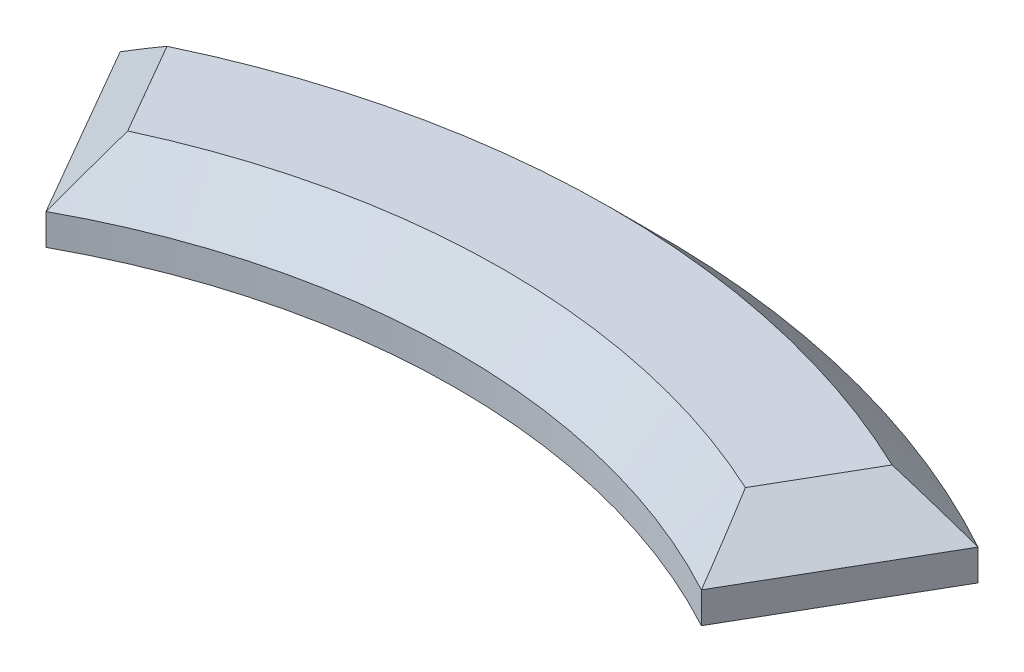
from build123d import *

# Parameters (mm, degrees)
BOSS_EXTRUDE1_DEPTH = 3.3
CHAMFER1_SIZE       = 2
SKETCH2_R           = 1.625
CUT_EXTRUDE1_DEPTH  = 2


with BuildPart() as part:
    # Sketch1 → Boss-Extrude1 (new body)
    with BuildSketch(Plane(origin=(0, 0, 0), x_dir=(1, 0, 0), z_dir=(0, 1, 0))):
        with BuildLine():
            Line((-17.971705397, 32.627906846), (-13.729256498, 25.279769804))
            ThreePointArc((-13.729256498, 25.279769804), (0, 28.767329478), (13.729256498, 25.279769804))
            Line((13.729256498, 25.279769804), (17.971705397, 32.627906846))
            ThreePointArc((17.971705397, 32.627906846), (0, 37.25), (-17.971705397, 32.627906846))
        make_face()
    extrude(amount=BOSS_EXTRUDE1_DEPTH)

    # Chamfer1
    chamfer1_edges = [part.edges().sort_by_distance(p)[0] for p in [
        (15.850480947, 3.3, -28.953838325),
        (0, 3.3, -37.25),
        (0, 3.3, -28.767329478),
        (-15.850480947, 3.3, -28.953838325),
    ]]
    chamfer(chamfer1_edges, length=CHAMFER1_SIZE)

    # Sketch2 → Cut-Extrude1 (cut)
    with BuildSketch(Plane.XZ):
        with Locations((0, -33.008664739)):
            Circle(SKETCH2_R)
    extrude(amount=-CUT_EXTRUDE1_DEPTH, mode=Mode.SUBTRACT)


solid = part.part
